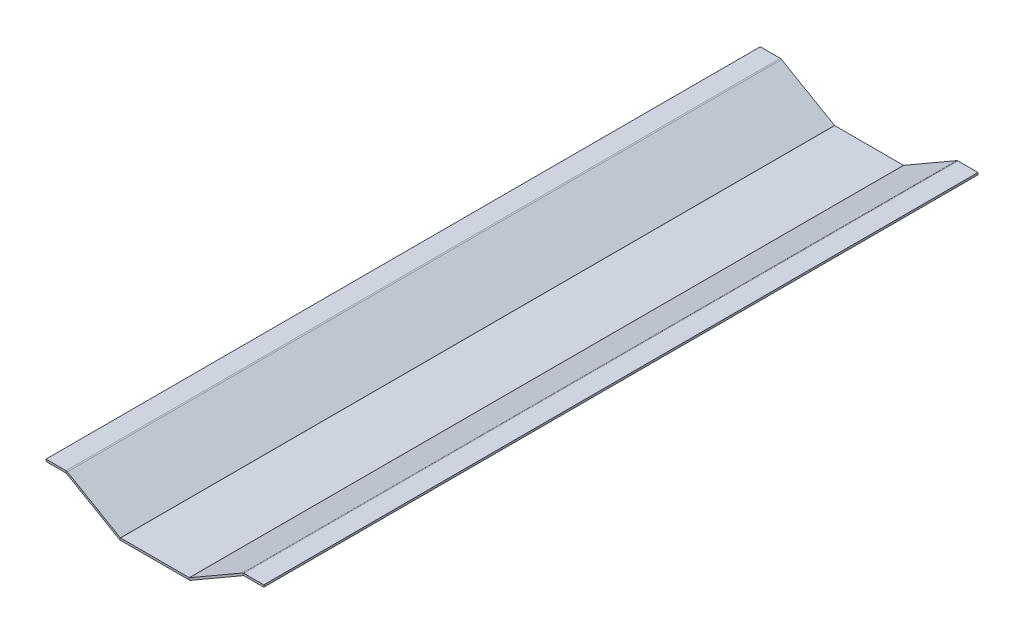
from build123d import *

# Parameters (mm, degrees)
SM_BASE_FLANGE_1_DEPTH = 518


# Sheet-metal steps are written as plain solids
with BuildPart() as part:
    # Sketch 1 → Базовая кромка1 (new body)
    with BuildSketch(Plane.XY):
        with BuildLine():
            Line((-157.942286341, 0), (-128.947095812, 0))
            ThreePointArc((-128.947095812, 0), (-127.976524393, -0.127778151), (-127.072095812, -0.502404736))
            Line((-127.072095812, -0.502404736), (-50.174038106, -44.899519053))
            ThreePointArc((-50.174038106, -44.899519053), (-49.99315239, -44.97444437), (-49.799038106, -45))
            Line((-49.799038106, -45), (49.799038106, -45))
            ThreePointArc((49.799038106, -45), (49.99315239, -44.97444437), (50.174038106, -44.899519053))
            Line((50.174038106, -44.899519053), (127.072095812, -0.502404736))
            ThreePointArc((127.072095812, -0.502404736), (127.976524393, -0.127778151), (128.947095812, 0))
            Line((128.947095812, 0), (157.942286341, 0))
            Line((157.942286341, 0), (157.942286341, -3))
            Line((157.942286341, -3), (128.947095812, -3))
            ThreePointArc((128.947095812, -3), (128.752981528, -3.02555563), (128.572095812, -3.100480947))
            Line((128.572095812, -3.100480947), (51.674038106, -47.497595264))
            ThreePointArc((51.674038106, -47.497595264), (50.769609525, -47.872221849), (49.799038106, -48))
            Line((49.799038106, -48), (-49.799038106, -48))
            ThreePointArc((-49.799038106, -48), (-50.769609525, -47.872221849), (-51.674038106, -47.497595264))
            Line((-51.674038106, -47.497595264), (-128.572095812, -3.100480947))
            ThreePointArc((-128.572095812, -3.100480947), (-128.752981528, -3.02555563), (-128.947095812, -3))
            Line((-128.947095812, -3), (-157.942286341, -3))
            Line((-157.942286341, -3), (-157.942286341, 0))
        make_face()
    extrude(amount=SM_BASE_FLANGE_1_DEPTH)

    # Зеркальное отражение1: part across plane


with BuildPart() as part_1:
    add(part.part)
    add(part.part.mirror(Plane(origin=(51.674038106, -47.497595264, 0), x_dir=(1, 0, 0), z_dir=(0, 0, -1))))


solid = part_1.part
